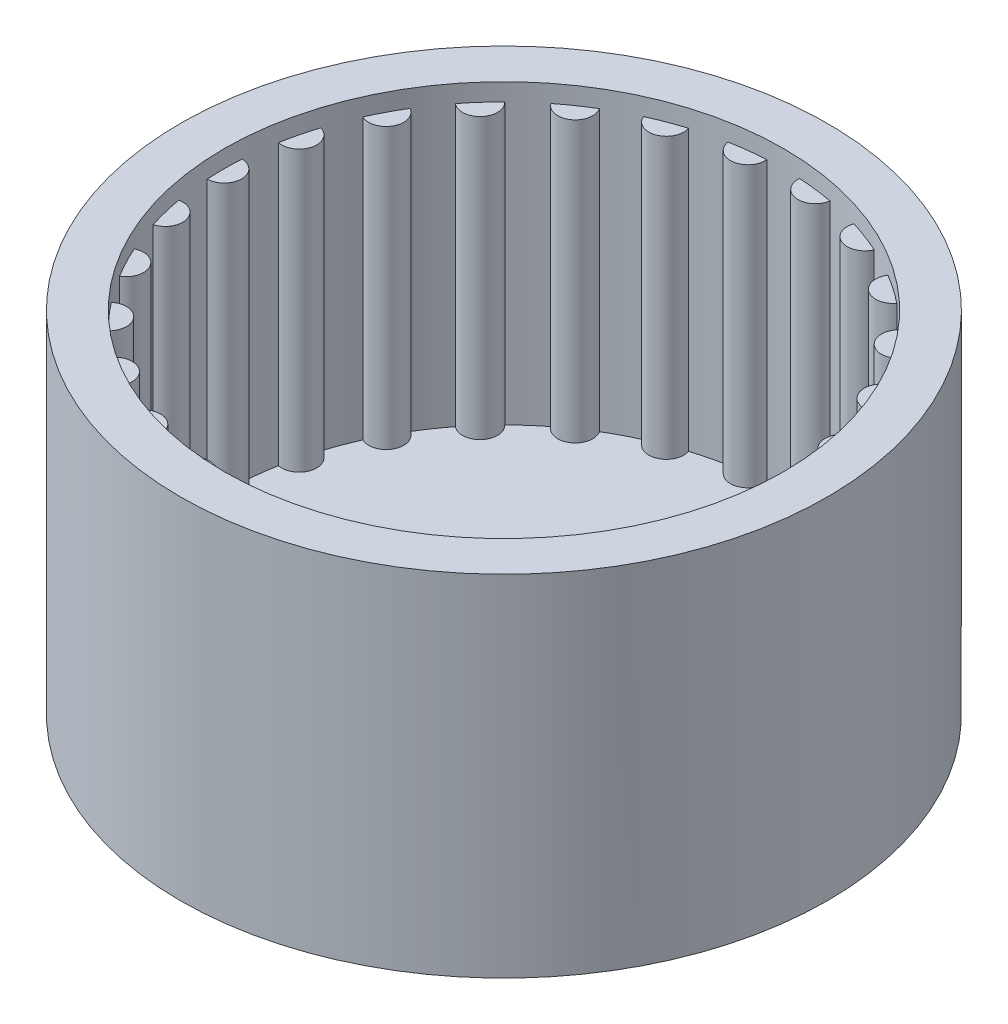
from build123d import *

# Parameters (mm, degrees)
BOSS_EXTRUDE1_DEPTH         = 8
BOSS_EXTRUDE1_DEPTH_BACK    = 8
SKETCH2_R                   = 1
BOSS_EXTRUDE1_2_DEPTH       = 8
BOSS_EXTRUDE1_2_DEPTH_BACK  = 8
BOSS_EXTRUDE1_3_DEPTH       = 8
BOSS_EXTRUDE1_3_DEPTH_BACK  = 8
BOSS_EXTRUDE1_4_DEPTH       = 8
BOSS_EXTRUDE1_4_DEPTH_BACK  = 8
BOSS_EXTRUDE1_5_DEPTH       = 8
BOSS_EXTRUDE1_5_DEPTH_BACK  = 8
BOSS_EXTRUDE1_6_DEPTH       = 8
BOSS_EXTRUDE1_6_DEPTH_BACK  = 8
BOSS_EXTRUDE1_7_DEPTH       = 8
BOSS_EXTRUDE1_7_DEPTH_BACK  = 8
BOSS_EXTRUDE1_8_DEPTH       = 8
BOSS_EXTRUDE1_8_DEPTH_BACK  = 8
BOSS_EXTRUDE1_9_DEPTH       = 8
BOSS_EXTRUDE1_9_DEPTH_BACK  = 8
BOSS_EXTRUDE1_10_DEPTH      = 8
BOSS_EXTRUDE1_10_DEPTH_BACK = 8
BOSS_EXTRUDE1_11_DEPTH      = 8
BOSS_EXTRUDE1_11_DEPTH_BACK = 8
BOSS_EXTRUDE1_12_DEPTH      = 8
BOSS_EXTRUDE1_12_DEPTH_BACK = 8
BOSS_EXTRUDE1_13_DEPTH      = 8
BOSS_EXTRUDE1_13_DEPTH_BACK = 8
BOSS_EXTRUDE1_14_DEPTH      = 8
BOSS_EXTRUDE1_14_DEPTH_BACK = 8
BOSS_EXTRUDE1_15_DEPTH      = 8
BOSS_EXTRUDE1_15_DEPTH_BACK = 8
BOSS_EXTRUDE1_16_DEPTH      = 8
BOSS_EXTRUDE1_16_DEPTH_BACK = 8
BOSS_EXTRUDE1_17_DEPTH      = 8
BOSS_EXTRUDE1_17_DEPTH_BACK = 8
BOSS_EXTRUDE1_18_DEPTH      = 8
BOSS_EXTRUDE1_18_DEPTH_BACK = 8
BOSS_EXTRUDE1_19_DEPTH      = 8
BOSS_EXTRUDE1_19_DEPTH_BACK = 8
BOSS_EXTRUDE1_20_DEPTH      = 8
BOSS_EXTRUDE1_20_DEPTH_BACK = 8
BOSS_EXTRUDE1_21_DEPTH      = 8
BOSS_EXTRUDE1_21_DEPTH_BACK = 8
BOSS_EXTRUDE1_22_DEPTH      = 8
BOSS_EXTRUDE1_22_DEPTH_BACK = 8
BOSS_EXTRUDE1_23_DEPTH      = 8
BOSS_EXTRUDE1_23_DEPTH_BACK = 8
BOSS_EXTRUDE1_24_DEPTH      = 8
BOSS_EXTRUDE1_24_DEPTH_BACK = 8
BOSS_EXTRUDE1_25_DEPTH      = 8
BOSS_EXTRUDE1_25_DEPTH_BACK = 8
BOSS_EXTRUDE1_26_DEPTH      = 8
BOSS_EXTRUDE1_26_DEPTH_BACK = 8
BOSS_EXTRUDE3_DEPTH         = 8
BOSS_EXTRUDE3_DEPTH_BACK    = 8
SKETCH5_R                   = 18.5
SKETCH5_R_2                 = 16
SKETCH6_R                   = 18.5
SKETCH6_R_2                 = 16
BOSS_EXTRUDE4_DEPTH         = 1
BOSS_EXTRUDE5_START         = 3
SKETCH8_R                   = 18.5
BOSS_EXTRUDE5_DEPTH         = 3
SKETCH9_R                   = 6
CUT_EXTRUDE1_DEPTH          = 3


with BuildPart() as part:
    # Sketch2 → Boss-Extrude1 (new, two sides: drawn at the far end of the back side and taken through both)
    with BuildSketch(Plane(origin=(0, 0, 0), x_dir=(1, 0, 0), z_dir=(0, 1, 0)).offset(-BOSS_EXTRUDE1_DEPTH_BACK)):
        with Locations((15.5, 0)):
            Circle(SKETCH2_R)
    extrude(amount=BOSS_EXTRUDE1_DEPTH + BOSS_EXTRUDE1_DEPTH_BACK)



with BuildPart() as body_2:
    # Sketch2 → Boss-Extrude1 2 (new, two sides: drawn at the far end of the back side and taken through both)
    with BuildSketch(Plane(origin=(0, 0, 0), x_dir=(1, 0, 0), z_dir=(0, 1, 0)).offset(-BOSS_EXTRUDE1_2_DEPTH_BACK)):
        with Locations((15.035069079, -3.829050629)):
            Circle(SKETCH2_R)
    extrude(amount=BOSS_EXTRUDE1_2_DEPTH + BOSS_EXTRUDE1_2_DEPTH_BACK)


with BuildPart() as body_3:
    # Sketch2 → Boss-Extrude1 3 (new, two sides: drawn at the far end of the back side and taken through both)
    with BuildSketch(Plane(origin=(0, 0, 0), x_dir=(1, 0, 0), z_dir=(0, 1, 0)).offset(-BOSS_EXTRUDE1_3_DEPTH_BACK)):
        with Locations((13.66729641, -7.435570753)):
            Circle(SKETCH2_R)
    extrude(amount=BOSS_EXTRUDE1_3_DEPTH + BOSS_EXTRUDE1_3_DEPTH_BACK)


with BuildPart() as body_4:
    # Sketch2 → Boss-Extrude1 4 (new, two sides: drawn at the far end of the back side and taken through both)
    with BuildSketch(Plane(origin=(0, 0, 0), x_dir=(1, 0, 0), z_dir=(0, 1, 0)).offset(-BOSS_EXTRUDE1_4_DEPTH_BACK)):
        with Locations((11.476171971, -10.609962532)):
            Circle(SKETCH2_R)
    extrude(amount=BOSS_EXTRUDE1_4_DEPTH + BOSS_EXTRUDE1_4_DEPTH_BACK)


with BuildPart() as body_5:
    # Sketch2 → Boss-Extrude1 5 (new, two sides: drawn at the far end of the back side and taken through both)
    with BuildSketch(Plane(origin=(0, 0, 0), x_dir=(1, 0, 0), z_dir=(0, 1, 0)).offset(-BOSS_EXTRUDE1_5_DEPTH_BACK)):
        with Locations((8.589035948, -13.167741854)):
            Circle(SKETCH2_R)
    extrude(amount=BOSS_EXTRUDE1_5_DEPTH + BOSS_EXTRUDE1_5_DEPTH_BACK)


with BuildPart() as body_6:
    # Sketch2 → Boss-Extrude1 6 (new, two sides: drawn at the far end of the back side and taken through both)
    with BuildSketch(Plane(origin=(0, 0, 0), x_dir=(1, 0, 0), z_dir=(0, 1, 0)).offset(-BOSS_EXTRUDE1_6_DEPTH_BACK)):
        with Locations((5.173678193, -14.960259883)):
            Circle(SKETCH2_R)
    extrude(amount=BOSS_EXTRUDE1_6_DEPTH + BOSS_EXTRUDE1_6_DEPTH_BACK)


with BuildPart() as body_7:
    # Sketch2 → Boss-Extrude1 7 (new, two sides: drawn at the far end of the back side and taken through both)
    with BuildSketch(Plane(origin=(0, 0, 0), x_dir=(1, 0, 0), z_dir=(0, 1, 0)).offset(-BOSS_EXTRUDE1_7_DEPTH_BACK)):
        with Locations((1.428586884, -15.883341986)):
            Circle(SKETCH2_R)
    extrude(amount=BOSS_EXTRUDE1_7_DEPTH + BOSS_EXTRUDE1_7_DEPTH_BACK)


with BuildPart() as body_8:
    # Sketch2 → Boss-Extrude1 8 (new, two sides: drawn at the far end of the back side and taken through both)
    with BuildSketch(Plane(origin=(0, 0, 0), x_dir=(1, 0, 0), z_dir=(0, 1, 0)).offset(-BOSS_EXTRUDE1_8_DEPTH_BACK)):
        with Locations((-2.428586884, -15.883341986)):
            Circle(SKETCH2_R)
    extrude(amount=BOSS_EXTRUDE1_8_DEPTH + BOSS_EXTRUDE1_8_DEPTH_BACK)


with BuildPart() as body_9:
    # Sketch2 → Boss-Extrude1 9 (new, two sides: drawn at the far end of the back side and taken through both)
    with BuildSketch(Plane(origin=(0, 0, 0), x_dir=(1, 0, 0), z_dir=(0, 1, 0)).offset(-BOSS_EXTRUDE1_9_DEPTH_BACK)):
        with Locations((-6.173678193, -14.960259883)):
            Circle(SKETCH2_R)
    extrude(amount=BOSS_EXTRUDE1_9_DEPTH + BOSS_EXTRUDE1_9_DEPTH_BACK)


with BuildPart() as body_10:
    # Sketch2 → Boss-Extrude1 10 (new, two sides: drawn at the far end of the back side and taken through both)
    with BuildSketch(Plane(origin=(0, 0, 0), x_dir=(1, 0, 0), z_dir=(0, 1, 0)).offset(-BOSS_EXTRUDE1_10_DEPTH_BACK)):
        with Locations((-9.589035948, -13.167741854)):
            Circle(SKETCH2_R)
    extrude(amount=BOSS_EXTRUDE1_10_DEPTH + BOSS_EXTRUDE1_10_DEPTH_BACK)


with BuildPart() as body_11:
    # Sketch2 → Boss-Extrude1 11 (new, two sides: drawn at the far end of the back side and taken through both)
    with BuildSketch(Plane(origin=(0, 0, 0), x_dir=(1, 0, 0), z_dir=(0, 1, 0)).offset(-BOSS_EXTRUDE1_11_DEPTH_BACK)):
        with Locations((-12.476171971, -10.609962532)):
            Circle(SKETCH2_R)
    extrude(amount=BOSS_EXTRUDE1_11_DEPTH + BOSS_EXTRUDE1_11_DEPTH_BACK)


with BuildPart() as body_12:
    # Sketch2 → Boss-Extrude1 12 (new, two sides: drawn at the far end of the back side and taken through both)
    with BuildSketch(Plane(origin=(0, 0, 0), x_dir=(1, 0, 0), z_dir=(0, 1, 0)).offset(-BOSS_EXTRUDE1_12_DEPTH_BACK)):
        with Locations((-14.66729641, -7.435570753)):
            Circle(SKETCH2_R)
    extrude(amount=BOSS_EXTRUDE1_12_DEPTH + BOSS_EXTRUDE1_12_DEPTH_BACK)


with BuildPart() as body_13:
    # Sketch2 → Boss-Extrude1 13 (new, two sides: drawn at the far end of the back side and taken through both)
    with BuildSketch(Plane(origin=(0, 0, 0), x_dir=(1, 0, 0), z_dir=(0, 1, 0)).offset(-BOSS_EXTRUDE1_13_DEPTH_BACK)):
        with Locations((-16.035069079, -3.829050629)):
            Circle(SKETCH2_R)
    extrude(amount=BOSS_EXTRUDE1_13_DEPTH + BOSS_EXTRUDE1_13_DEPTH_BACK)


with BuildPart() as body_14:
    # Sketch2 → Boss-Extrude1 14 (new, two sides: drawn at the far end of the back side and taken through both)
    with BuildSketch(Plane(origin=(0, 0, 0), x_dir=(1, 0, 0), z_dir=(0, 1, 0)).offset(-BOSS_EXTRUDE1_14_DEPTH_BACK)):
        with Locations((-16.5, 0)):
            Circle(SKETCH2_R)
    extrude(amount=BOSS_EXTRUDE1_14_DEPTH + BOSS_EXTRUDE1_14_DEPTH_BACK)


with BuildPart() as body_15:
    # Sketch2 → Boss-Extrude1 15 (new, two sides: drawn at the far end of the back side and taken through both)
    with BuildSketch(Plane(origin=(0, 0, 0), x_dir=(1, 0, 0), z_dir=(0, 1, 0)).offset(-BOSS_EXTRUDE1_15_DEPTH_BACK)):
        with Locations((-16.035069079, 3.829050629)):
            Circle(SKETCH2_R)
    extrude(amount=BOSS_EXTRUDE1_15_DEPTH + BOSS_EXTRUDE1_15_DEPTH_BACK)


with BuildPart() as body_16:
    # Sketch2 → Boss-Extrude1 16 (new, two sides: drawn at the far end of the back side and taken through both)
    with BuildSketch(Plane(origin=(0, 0, 0), x_dir=(1, 0, 0), z_dir=(0, 1, 0)).offset(-BOSS_EXTRUDE1_16_DEPTH_BACK)):
        with Locations((-14.66729641, 7.435570753)):
            Circle(SKETCH2_R)
    extrude(amount=BOSS_EXTRUDE1_16_DEPTH + BOSS_EXTRUDE1_16_DEPTH_BACK)


with BuildPart() as body_17:
    # Sketch2 → Boss-Extrude1 17 (new, two sides: drawn at the far end of the back side and taken through both)
    with BuildSketch(Plane(origin=(0, 0, 0), x_dir=(1, 0, 0), z_dir=(0, 1, 0)).offset(-BOSS_EXTRUDE1_17_DEPTH_BACK)):
        with Locations((-12.476171971, 10.609962532)):
            Circle(SKETCH2_R)
    extrude(amount=BOSS_EXTRUDE1_17_DEPTH + BOSS_EXTRUDE1_17_DEPTH_BACK)


with BuildPart() as body_18:
    # Sketch2 → Boss-Extrude1 18 (new, two sides: drawn at the far end of the back side and taken through both)
    with BuildSketch(Plane(origin=(0, 0, 0), x_dir=(1, 0, 0), z_dir=(0, 1, 0)).offset(-BOSS_EXTRUDE1_18_DEPTH_BACK)):
        with Locations((-9.589035948, 13.167741854)):
            Circle(SKETCH2_R)
    extrude(amount=BOSS_EXTRUDE1_18_DEPTH + BOSS_EXTRUDE1_18_DEPTH_BACK)


with BuildPart() as body_19:
    # Sketch2 → Boss-Extrude1 19 (new, two sides: drawn at the far end of the back side and taken through both)
    with BuildSketch(Plane(origin=(0, 0, 0), x_dir=(1, 0, 0), z_dir=(0, 1, 0)).offset(-BOSS_EXTRUDE1_19_DEPTH_BACK)):
        with Locations((-6.173678193, 14.960259883)):
            Circle(SKETCH2_R)
    extrude(amount=BOSS_EXTRUDE1_19_DEPTH + BOSS_EXTRUDE1_19_DEPTH_BACK)


with BuildPart() as body_20:
    # Sketch2 → Boss-Extrude1 20 (new, two sides: drawn at the far end of the back side and taken through both)
    with BuildSketch(Plane(origin=(0, 0, 0), x_dir=(1, 0, 0), z_dir=(0, 1, 0)).offset(-BOSS_EXTRUDE1_20_DEPTH_BACK)):
        with Locations((-2.428586884, 15.883341986)):
            Circle(SKETCH2_R)
    extrude(amount=BOSS_EXTRUDE1_20_DEPTH + BOSS_EXTRUDE1_20_DEPTH_BACK)


with BuildPart() as body_21:
    # Sketch2 → Boss-Extrude1 21 (new, two sides: drawn at the far end of the back side and taken through both)
    with BuildSketch(Plane(origin=(0, 0, 0), x_dir=(1, 0, 0), z_dir=(0, 1, 0)).offset(-BOSS_EXTRUDE1_21_DEPTH_BACK)):
        with Locations((1.428586884, 15.883341986)):
            Circle(SKETCH2_R)
    extrude(amount=BOSS_EXTRUDE1_21_DEPTH + BOSS_EXTRUDE1_21_DEPTH_BACK)


with BuildPart() as body_22:
    # Sketch2 → Boss-Extrude1 22 (new, two sides: drawn at the far end of the back side and taken through both)
    with BuildSketch(Plane(origin=(0, 0, 0), x_dir=(1, 0, 0), z_dir=(0, 1, 0)).offset(-BOSS_EXTRUDE1_22_DEPTH_BACK)):
        with Locations((5.173678193, 14.960259883)):
            Circle(SKETCH2_R)
    extrude(amount=BOSS_EXTRUDE1_22_DEPTH + BOSS_EXTRUDE1_22_DEPTH_BACK)


with BuildPart() as body_23:
    # Sketch2 → Boss-Extrude1 23 (new, two sides: drawn at the far end of the back side and taken through both)
    with BuildSketch(Plane(origin=(0, 0, 0), x_dir=(1, 0, 0), z_dir=(0, 1, 0)).offset(-BOSS_EXTRUDE1_23_DEPTH_BACK)):
        with Locations((8.589035948, 13.167741854)):
            Circle(SKETCH2_R)
    extrude(amount=BOSS_EXTRUDE1_23_DEPTH + BOSS_EXTRUDE1_23_DEPTH_BACK)


with BuildPart() as body_24:
    # Sketch2 → Boss-Extrude1 24 (new, two sides: drawn at the far end of the back side and taken through both)
    with BuildSketch(Plane(origin=(0, 0, 0), x_dir=(1, 0, 0), z_dir=(0, 1, 0)).offset(-BOSS_EXTRUDE1_24_DEPTH_BACK)):
        with Locations((11.476171971, 10.609962532)):
            Circle(SKETCH2_R)
    extrude(amount=BOSS_EXTRUDE1_24_DEPTH + BOSS_EXTRUDE1_24_DEPTH_BACK)


with BuildPart() as body_25:
    # Sketch2 → Boss-Extrude1 25 (new, two sides: drawn at the far end of the back side and taken through both)
    with BuildSketch(Plane(origin=(0, 0, 0), x_dir=(1, 0, 0), z_dir=(0, 1, 0)).offset(-BOSS_EXTRUDE1_25_DEPTH_BACK)):
        with Locations((13.66729641, 7.435570753)):
            Circle(SKETCH2_R)
    extrude(amount=BOSS_EXTRUDE1_25_DEPTH + BOSS_EXTRUDE1_25_DEPTH_BACK)


with BuildPart() as body_26:
    # Sketch2 → Boss-Extrude1 26 (new, two sides: drawn at the far end of the back side and taken through both)
    with BuildSketch(Plane(origin=(0, 0, 0), x_dir=(1, 0, 0), z_dir=(0, 1, 0)).offset(-BOSS_EXTRUDE1_26_DEPTH_BACK)):
        with Locations((15.035069079, 3.829050629)):
            Circle(SKETCH2_R)
    extrude(amount=BOSS_EXTRUDE1_26_DEPTH + BOSS_EXTRUDE1_26_DEPTH_BACK)


with BuildPart() as part_1:
    add(part.part)

    add(body_2.part)  # Boss-Extrude3 merges body 2

    add(body_3.part)  # Boss-Extrude3 merges body 3

    add(body_4.part)  # Boss-Extrude3 merges body 4

    add(body_5.part)  # Boss-Extrude3 merges body 5

    add(body_6.part)  # Boss-Extrude3 merges body 6

    add(body_7.part)  # Boss-Extrude3 merges body 7

    add(body_8.part)  # Boss-Extrude3 merges body 8

    add(body_9.part)  # Boss-Extrude3 merges body 9

    add(body_10.part)  # Boss-Extrude3 merges body 10

    add(body_11.part)  # Boss-Extrude3 merges body 11

    add(body_12.part)  # Boss-Extrude3 merges body 12

    add(body_13.part)  # Boss-Extrude3 merges body 13

    add(body_14.part)  # Boss-Extrude3 merges body 14

    add(body_15.part)  # Boss-Extrude3 merges body 15

    add(body_16.part)  # Boss-Extrude3 merges body 16

    add(body_17.part)  # Boss-Extrude3 merges body 17

    add(body_18.part)  # Boss-Extrude3 merges body 18

    add(body_19.part)  # Boss-Extrude3 merges body 19

    add(body_20.part)  # Boss-Extrude3 merges body 20

    add(body_21.part)  # Boss-Extrude3 merges body 21

    add(body_22.part)  # Boss-Extrude3 merges body 22

    add(body_23.part)  # Boss-Extrude3 merges body 23

    add(body_24.part)  # Boss-Extrude3 merges body 24

    add(body_25.part)  # Boss-Extrude3 merges body 25

    add(body_26.part)  # Boss-Extrude3 merges body 26
    # Sketch5 → Boss-Extrude3 (add, two sides: drawn at the far end of the back side and taken through both)
    with BuildSketch(Plane(origin=(0, 0, 0), x_dir=(1, 0, 0), z_dir=(0, 1, 0)).offset(-BOSS_EXTRUDE3_DEPTH_BACK)):
        with Locations((-0.5, 0)):
            Circle(SKETCH5_R)
        with Locations((-0.5, 0)):
            Circle(SKETCH5_R_2, mode=Mode.SUBTRACT)
    extrude(amount=BOSS_EXTRUDE3_DEPTH + BOSS_EXTRUDE3_DEPTH_BACK)

    # Sketch6 → Boss-Extrude4 (add)
    with BuildSketch(Plane(origin=(0, 8, 0), x_dir=(1, 0, 0), z_dir=(0, 1, 0))):
        with Locations((-0.5, 0)):
            Circle(SKETCH6_R)
        with Locations((-0.5, 0)):
            Circle(SKETCH6_R_2, mode=Mode.SUBTRACT)
    extrude(amount=BOSS_EXTRUDE4_DEPTH)

    # Sketch8 → Boss-Extrude5 (add)
    with BuildSketch(Plane.XZ.offset(8).offset(BOSS_EXTRUDE5_START)):
        with Locations((-0.5, 0)):
            Circle(SKETCH8_R)
    extrude(amount=-BOSS_EXTRUDE5_DEPTH)

    # Sketch9 → Cut-Extrude1 (cut)
    with BuildSketch(Plane.XZ.offset(11)):
        with Locations((-0.5, 0)):
            Circle(SKETCH9_R)
    extrude(amount=-CUT_EXTRUDE1_DEPTH, mode=Mode.SUBTRACT)


solid = part_1.part
